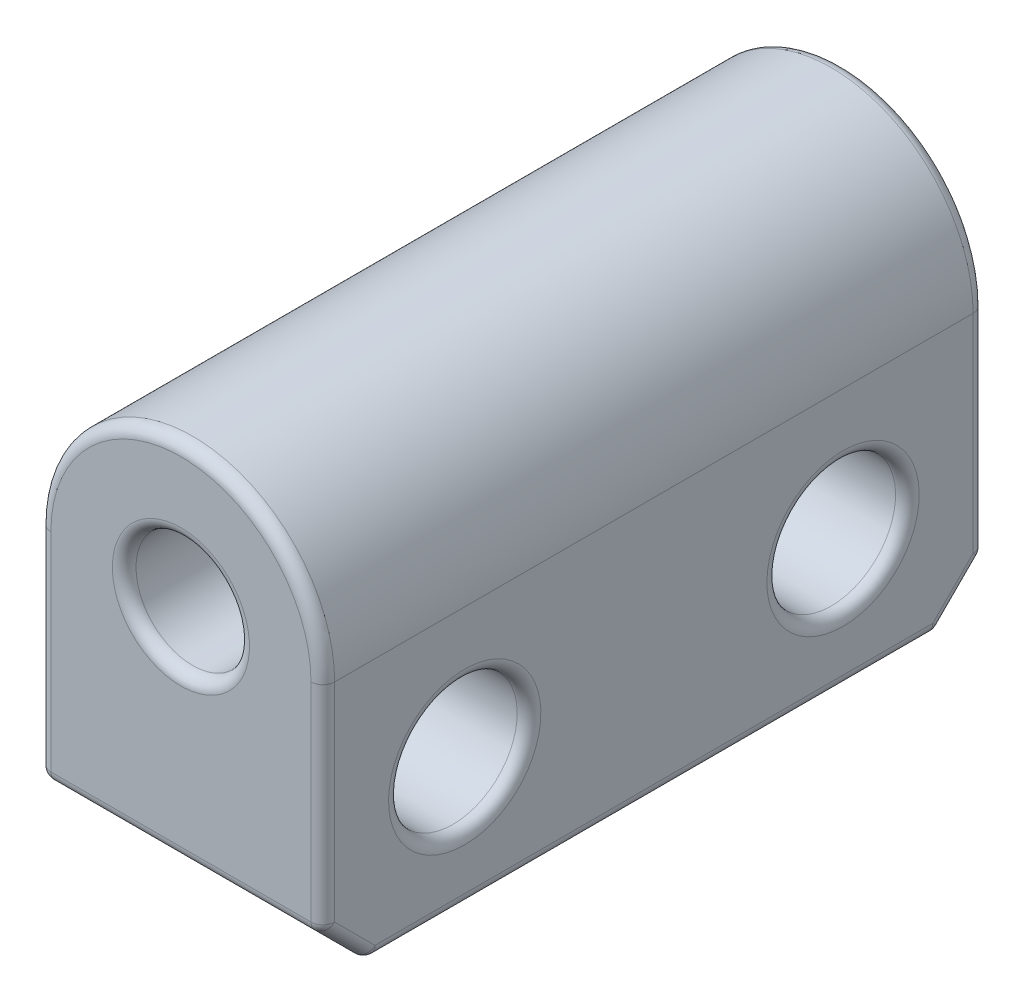
from build123d import *

# Parameters (mm, degrees)
SKETCH1_R           = 1.905
BOSS_EXTRUDE1_DEPTH = 11.1125
SKETCH3_R           = 1.905
BOSS_EXTRUDE2_DEPTH = 1.984375
SKETCH2_R           = 2.159
CUT_EXTRUDE1_DEPTH  = 18.042535252
CHAMFER2_SIZE       = 1.5875
FILLET2_R           = 0.396875


with BuildPart() as part:
    # Sketch1 → Boss-Extrude1 (new, symmetric)
    with BuildSketch(Plane.XY):
        with BuildLine():
            Line((-4.7625, 0), (-4.7625, -8.73125))
            Line((-4.7625, -8.73125), (4.7625, -8.73125))
            Line((4.7625, -8.73125), (4.7625, 0))
            ThreePointArc((4.7625, 0), (0, 4.7625), (-4.7625, 0))
        make_face()
        Circle(SKETCH1_R, mode=Mode.SUBTRACT)
    extrude(amount=BOSS_EXTRUDE1_DEPTH, both=True)

    # Sketch3 → Boss-Extrude2 (add, symmetric)
    with BuildSketch(Plane.XY):
        Circle(SKETCH3_R)
    extrude(amount=BOSS_EXTRUDE2_DEPTH, both=True)

    # Sketch2 → Cut-Extrude1 (cut, through all)
    with BuildSketch(Plane.ZY.offset(4.7625)):
        with Locations((-6.35, -4.365625)):
            Circle(SKETCH2_R)
        with Locations((6.35, -4.365625)):
            Circle(SKETCH2_R)
    extrude(amount=-CUT_EXTRUDE1_DEPTH, mode=Mode.SUBTRACT)

    # Chamfer2
    chamfer2_edges = [part.edges().sort_by_distance(p)[0] for p in [
        (0, -8.73125, 11.1125),
        (0, -8.73125, -11.1125),
    ]]
    chamfer(chamfer2_edges, length=CHAMFER2_SIZE)

    # Fillet2
    fillet2_edges = [part.edges().sort_by_distance(p)[0] for p in [
        (0, -7.14375, -11.1125),
        (-4.7625, -7.9375, 10.31875),
        (-4.7625, -7.9375, -10.31875),
        (0, -8.73125, 9.525),
        (0, -8.73125, -9.525),
        (4.7625, -7.9375, 10.31875),
        (4.7625, -7.9375, -10.31875),
        (0, -7.14375, 11.1125),
        (-4.7625, -8.73125, 0),
        (4.7625, -8.73125, 0),
        (4.7625, -3.571875, 11.1125),
        (-4.7625, -3.571875, 11.1125),
        (0, 4.7625, 11.1125),
        (4.7625, -3.571875, -11.1125),
        (-4.7625, -3.571875, -11.1125),
        (0, 4.7625, -11.1125),
        (4.7625, -4.365625, -8.509),
        (-4.7625, -4.365625, -8.509),
        (-4.7625, -4.365625, 4.191),
        (4.7625, -4.365625, 4.191),
        (-1.905, 0, 11.1125),
        (-1.905, 0, -11.1125),
    ]]
    fillet(fillet2_edges, radius=FILLET2_R)


solid = part.part
